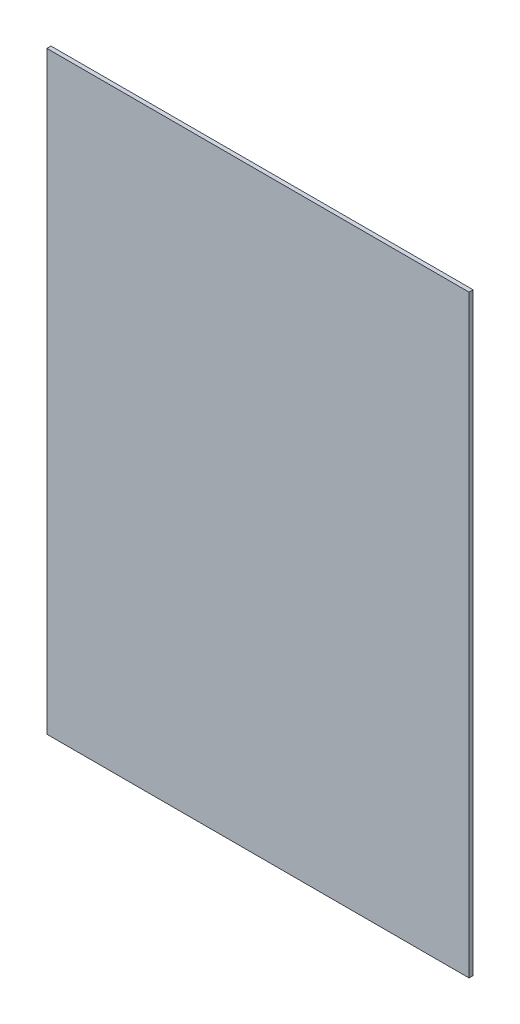
from build123d import *

# Parameters (mm, degrees)
SKETCH_1_W      = 620.3
SKETCH_1_H      = 872.6
EXTRUDE_1_DEPTH = 6


with BuildPart() as part:
    # Эскиз1 → Бобышка-Вытянуть1 (new body)
    with BuildSketch(Plane.XY):
        with Locations((-828.15, 0)):
            Rectangle(SKETCH_1_W, SKETCH_1_H)
    extrude(amount=-EXTRUDE_1_DEPTH)


solid = part.part
